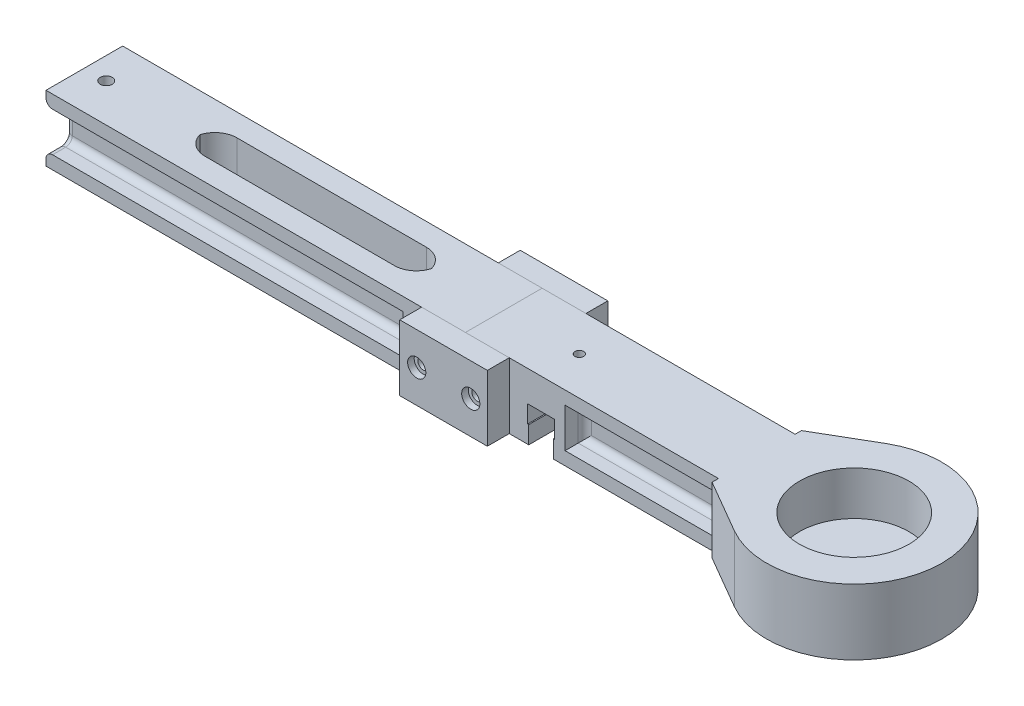
from build123d import *

# Parameters (mm, degrees)
SKETCH2_W                = 247
SKETCH2_H                = 35
BOSS_EXTRUDE1_DEPTH      = 30
SKETCH3_R                = 5.6
CUT_EXTRUDE1_DEPTH       = 250.429849858
CUT_EXTRUDE2_DEPTH       = 22
SKETCH6_W                = 22.496439662
SKETCH6_H                = 14
BOSS_EXTRUDE3_DEPTH      = 38
CUT_EXTRUDE4_DEPTH       = 17.5
SKETCH9_R                = 2
CUT_EXTRUDE5_DEPTH       = 38
SKETCH15_R               = 2.75
CUT_EXTRUDE10_DEPTH      = 9
CUT_EXTRUDE11_DEPTH      = 21
SKETCH19_W               = 35
SKETCH19_H               = 30
BOSS_EXTRUDE5_DEPTH      = 55
BOSS_EXTRUDE4_DEPTH      = 30
SKETCH21_R               = 25
CUT_EXTRUDE14_DEPTH      = 20
SPLIT1_SURFACE_1_BACK    = 401.716
SPLIT1_SURFACE_1_DEPTH   = 803.432
SPLIT1_SURFACE_2_BACK    = 401.716
SPLIT1_SURFACE_2_DEPTH   = 803.432
SKETCH24_W               = 40
SKETCH24_H               = 30
BOSS_EXTRUDE6_DEPTH      = 10
SKETCH26_W               = 40
SKETCH26_H               = 30
BOSS_EXTRUDE7_DEPTH      = 10
SKETCH27_R               = 2.5
CUT_EXTRUDE15_DEPTH      = 258.808553
CUT_EXTRUDE17_DEPTH      = 3
SKETCH32_R               = 4.15
CUT_EXTRUDE18_DEPTH      = 3
SKETCH33_W               = 48.781261606
SKETCH33_H               = 44.034445694
CUT_EXTRUDE19_DEPTH      = 163
CUT_EXTRUDE20_DEPTH      = 60
CUT_EXTRUDE20_DEPTH_BACK = 10
SKETCH34_W               = 48.781261606
SKETCH34_H               = 44.034445694
FILLET3_R                = 3
FILLET4_R                = 3
SKETCH29_W               = 106.543232212
SKETCH29_H               = 14.581631154
CUT_EXTRUDE16_DEPTH      = 253.00992044
FILLET2_R                = 10


with BuildPart() as part:
    # Sketch2 → Boss-Extrude1 (new body)
    with BuildSketch(Plane(origin=(0, 0, 0), x_dir=(1, 0, 0), z_dir=(0, 1, 0))):
        with Locations((-123.5, 0)):
            Rectangle(SKETCH2_W, SKETCH2_H)
    extrude(amount=BOSS_EXTRUDE1_DEPTH)

    # Sketch3 → Cut-Extrude1 (cut, through all)
    with BuildSketch(Plane.XZ):
        with Locations(Location((-21, 0, 0), (0, 0, 270))):
            Circle(SKETCH3_R)
    extrude(amount=-CUT_EXTRUDE1_DEPTH, mode=Mode.SUBTRACT)

    # Sketch4 → Cut-Extrude2 (cut)
    with BuildSketch(Plane(origin=(0, 30, 0), x_dir=(1, 0, 0), z_dir=(0, 1, 0))):
        Polygon((-14.9, 3.521836642), (-21, 7.043673284), (-27.1, 3.521836642), (-27.1, -3.521836642), (-21, -7.043673284), (-14.9, -3.521836642), align=None)
    extrude(amount=-CUT_EXTRUDE2_DEPTH, mode=Mode.SUBTRACT)

    # Sketch6 → Boss-Extrude3 (add)
    with BuildSketch(Plane(origin=(0, 0, 0), x_dir=(0, 0, -1), z_dir=(1, 0, 0))):
        with Locations((0.204742288, 23)):
            Rectangle(SKETCH6_W, SKETCH6_H)
    extrude(amount=-BOSS_EXTRUDE3_DEPTH)

    # Sketch7 → Cut-Extrude4 (cut)
    with BuildSketch(Plane.XY.offset(17.5)):
        Polygon((-21, 16), (-14.9, 16), (-14.9, 8), (-15.4, 8), (-15.4, 0), (-26.6, 0), (-26.6, 8), (-27.1, 8), (-27.1, 16), align=None)
    extrude(amount=-CUT_EXTRUDE4_DEPTH, mode=Mode.SUBTRACT)

    # Sketch9 → Cut-Extrude5 (cut)
    with BuildSketch(Plane(origin=(0, 30, 0), x_dir=(1, 0, 0), z_dir=(0, 1, 0))):
        with Locations(Location((-21, 0, 0), (0, 0, 270))):
            Circle(SKETCH9_R)
    extrude(amount=-CUT_EXTRUDE5_DEPTH, mode=Mode.SUBTRACT)

    # Sketch15 → Cut-Extrude10 (cut)
    with BuildSketch(Plane(origin=(0, 30, 0), x_dir=(1, 0, 0), z_dir=(0, 1, 0))):
        with Locations(Location((-237, 0, 0), (0, 0, 270))):
            Circle(SKETCH15_R)
    extrude(amount=-CUT_EXTRUDE10_DEPTH, mode=Mode.SUBTRACT)

    # Sketch16 → Cut-Extrude11 (cut)
    with BuildSketch(Plane.XZ):
        Polygon((-241.130206964, 2.650419546), (-241.36043414, -2.25165438), (-237.230227176, -4.902073926), (-232.869793036, -2.650419546), (-232.63956586, 2.25165438), (-236.769772824, 4.902073926), align=None)
    extrude(amount=-CUT_EXTRUDE11_DEPTH, mode=Mode.SUBTRACT)

    # Sketch19 → Boss-Extrude5 (add)
    with BuildSketch(Plane(origin=(0, 0, 0), x_dir=(0, 0, -1), z_dir=(1, 0, 0))):
        with Locations((0, 15)):
            Rectangle(SKETCH19_W, SKETCH19_H)
    extrude(amount=BOSS_EXTRUDE5_DEPTH)

    # Sketch18 → Boss-Extrude4 (add)
    with BuildSketch(Plane(origin=(0, 30, 0), x_dir=(1, 0, 0), z_dir=(0, 1, 0))):
        with BuildLine():
            Line((55, 17.5), (55, -17.5))
            Line((55, -17.5), (84.405509337, -34.58567742))
            ThreePointArc((84.405509337, -34.58567742), (144.501054052, 0), (84.405509337, 34.58567742))
            Line((84.405509337, 34.58567742), (55, 17.5))
        make_face()
    extrude(amount=-BOSS_EXTRUDE4_DEPTH)

    # Sketch21 → Cut-Extrude14 (cut)
    with BuildSketch(Plane(origin=(0, 30, 0), x_dir=(1, 0, 0), z_dir=(0, 1, 0))):
        with Locations(Location((104.501054052, 0, 0), (0, 0, 270))):
            Circle(SKETCH21_R)
    extrude(amount=-CUT_EXTRUDE14_DEPTH, mode=Mode.SUBTRACT)


with BuildPart() as body_2:
    # Split1: the piece behind the surface
    add(part.part)
    # Split1 surface: a surface, the sketch's curves swept straight by 803.432 mm
    with BuildLine(Plane.XY.offset(17.5).offset(-SPLIT1_SURFACE_1_BACK), mode=Mode.PRIVATE) as split1_surface_1_path:
        Line((-55.498945948, 91.555969674), (-55.498945948, -31.555969674))
    split1_surface_1 = Shell.extrude(split1_surface_1_path.wire(), (0 * SPLIT1_SURFACE_1_DEPTH, 0 * SPLIT1_SURFACE_1_DEPTH, 1 * SPLIT1_SURFACE_1_DEPTH))
    split(bisect_by=split1_surface_1, keep=Keep.BOTTOM)


with BuildPart() as part_1:
    add(part.part)

    # Split1: split by a surface, the side it looks to stays
    # Split1 surface: a surface, the sketch's curves swept straight by 803.432 mm
    with BuildLine(Plane.XY.offset(17.5).offset(-SPLIT1_SURFACE_2_BACK), mode=Mode.PRIVATE) as split1_surface_2_path:
        Line((-55.498945948, 91.555969674), (-55.498945948, -31.555969674))
    split1_surface_2 = Shell.extrude(split1_surface_2_path.wire(), (0 * SPLIT1_SURFACE_2_DEPTH, 0 * SPLIT1_SURFACE_2_DEPTH, 1 * SPLIT1_SURFACE_2_DEPTH))
    split(bisect_by=split1_surface_2, keep=Keep.TOP)


with BuildPart() as body_3:
    # Sketch24 → Boss-Extrude6 (new body)
    with BuildSketch(Plane.XY.offset(17.5)):
        with Locations((-55.498945948, 15)):
            Rectangle(SKETCH24_W, SKETCH24_H)
    extrude(amount=BOSS_EXTRUDE6_DEPTH)


with BuildPart() as body_4:
    # Sketch26 → Boss-Extrude7 (new body)
    with BuildSketch(Plane(origin=(0, 0, -17.5), x_dir=(-1, 0, 0), z_dir=(0, 0, -1))):
        with Locations((55.498945948, 15)):
            Rectangle(SKETCH26_W, SKETCH26_H)
    extrude(amount=BOSS_EXTRUDE7_DEPTH)


with BuildPart() as cut_extrude15_tool:
    # Sketch27 → Cut-Extrude15 (new, through all)
    with BuildSketch(Plane(origin=(0, 0, -27.5), x_dir=(-1, 0, 0), z_dir=(0, 0, -1))):
        with Locations((43.074019262, 15)):
            Circle(SKETCH27_R)
        with Locations((67.746141025, 15)):
            Circle(SKETCH27_R)
    extrude(amount=-CUT_EXTRUDE15_DEPTH)


with BuildPart() as part_2:
    add(part_1.part)

    # Cut-Extrude15: cut by cut_extrude15_tool
    add(cut_extrude15_tool.part, mode=Mode.SUBTRACT)

    # Sketch34 → Cut-Extrude20 (cut, two sides: drawn at the far end of the back side and taken through both)
    with BuildSketch(Plane(origin=(0, 0, 0), x_dir=(0, 0, -1), z_dir=(1, 0, 0)).offset(-CUT_EXTRUDE20_DEPTH_BACK)):
        with Locations((0, 15)):
            Rectangle(SKETCH34_W, SKETCH34_H)
        Polygon((-17.5, 30), (-17.5, 24), (-8.5, 24), (-8.5, 6), (-17.5, 6), (-17.5, 0), (17.5, 0), (17.5, 6), (8.5, 6), (8.5, 24), (17.5, 24), (17.5, 30), align=None, mode=Mode.SUBTRACT)
    extrude(amount=CUT_EXTRUDE20_DEPTH + CUT_EXTRUDE20_DEPTH_BACK, mode=Mode.SUBTRACT)

    # Fillet4
    fillet4_edges = [part_2.edges().sort_by_distance(p)[0] for p in [
        (-10, 15, 8.5),
        (25, 24, 8.5),
        (25, 6, 8.5),
        (60, 15, 8.5),
        (25, 6, -8.5),
        (25, 24, -8.5),
        (60, 15, -8.5),
        (-10, 15, -8.5),
    ]]
    fillet(fillet4_edges, radius=FILLET4_R)


with BuildPart() as body_2_1:
    add(body_2.part)

    # Cut-Extrude15: cut by cut_extrude15_tool
    add(cut_extrude15_tool.part, mode=Mode.SUBTRACT)

    # Sketch33 → Cut-Extrude19 (cut)
    with BuildSketch(Plane.ZY.offset(247)):
        with Locations((0, 15)):
            Rectangle(SKETCH33_W, SKETCH33_H)
        Polygon((-17.5, 30), (-17.5, 24), (-8.5, 24), (-8.5, 6), (-17.5, 6), (-17.5, 0), (17.5, 0), (17.5, 6), (8.5, 6), (8.5, 24), (17.5, 24), (17.5, 30), align=None, mode=Mode.SUBTRACT)
    extrude(amount=-CUT_EXTRUDE19_DEPTH, mode=Mode.SUBTRACT)

    # Fillet3
    fillet3_edges = [body_2_1.edges().sort_by_distance(p)[0] for p in [
        (-84, 15, 8.5),
        (-84, 15, -8.5),
        (-247, 24, 13),
        (-165.5, 24, 8.5),
        (-247, 15, 8.5),
        (-165.5, 6, 8.5),
        (-247, 6, 13),
        (-247, 6, -13),
        (-165.5, 6, -8.5),
        (-247, 15, -8.5),
        (-165.5, 24, -8.5),
        (-247, 24, -13),
    ]]
    fillet(fillet3_edges, radius=FILLET3_R)

    # Sketch29 → Cut-Extrude16 (cut, through all)
    with BuildSketch(Plane(origin=(0, 30, 0), x_dir=(1, 0, 0), z_dir=(0, 1, 0))):
        with Locations((-141.397853243, 0)):
            Rectangle(SKETCH29_W, SKETCH29_H)
    extrude(amount=-CUT_EXTRUDE16_DEPTH, mode=Mode.SUBTRACT)

    # Fillet2
    # the kernel refuses this fillet: 10 mm, written as the material it adds along each edge
    with BuildSketch(Plane(origin=(-194.669469349, 30, 7.290815577), x_dir=(0, 0, -1), z_dir=(0, -1, 0)), Plane(origin=(-194.669469349, 30, -7.290815577), x_dir=(1, 0, 0), z_dir=(0, -1, 0)), Plane(origin=(-88.126237137, 30, -7.290815577), x_dir=(0, 0, 1), z_dir=(0, -1, 0))) as fillet2_piece_1:
        with BuildLine():
            CenterArc((FILLET2_R, FILLET2_R), FILLET2_R, 180, 90)
            Line((0, FILLET2_R), (0, 0))
            Line((0, 0), (FILLET2_R, 0))
        make_face()
    extrude(amount=30)
    with BuildSketch(Plane(origin=(-88.126237137, 30, 7.290815577), x_dir=(0, 0, -1), z_dir=(0, -1, 0))) as fillet2_piece_2:
        with BuildLine():
            CenterArc((FILLET2_R, -FILLET2_R), FILLET2_R, 90, 90)
            Line((0, -FILLET2_R), (0, 0))
            Line((0, 0), (FILLET2_R, 0))
        make_face()
    extrude(amount=30)


with BuildPart() as body_3_1:
    add(body_3.part)

    # Cut-Extrude15: cut by cut_extrude15_tool
    add(cut_extrude15_tool.part, mode=Mode.SUBTRACT)

    # Sketch32 → Cut-Extrude18 (cut)
    with BuildSketch(Plane.XY.offset(27.5)):
        with Locations((-67.746141025, 15)):
            Circle(SKETCH32_R)
        with Locations((-43.074019262, 15)):
            Circle(SKETCH32_R)
    extrude(amount=-CUT_EXTRUDE18_DEPTH, mode=Mode.SUBTRACT)


with BuildPart() as body_4_1:
    add(body_4.part)

    # Cut-Extrude15: cut by cut_extrude15_tool
    add(cut_extrude15_tool.part, mode=Mode.SUBTRACT)

    # Sketch31 → Cut-Extrude17 (cut)
    with BuildSketch(Plane(origin=(0, 0, -27.5), x_dir=(-1, 0, 0), z_dir=(0, 0, -1))):
        Polygon((45.441155366, 10.9), (47.808291469, 15), (45.441155366, 19.1), (40.706883158, 19.1), (38.339747055, 15), (40.706883158, 10.9), align=None)
        Polygon((70.113277128, 10.9), (72.480413232, 15), (70.113277128, 19.1), (65.379004921, 19.1), (63.011868817, 15), (65.379004921, 10.9), align=None)
    extrude(amount=-CUT_EXTRUDE17_DEPTH, mode=Mode.SUBTRACT)


solid = Compound([part_2.part, body_2_1.part, body_3_1.part, body_4_1.part])
